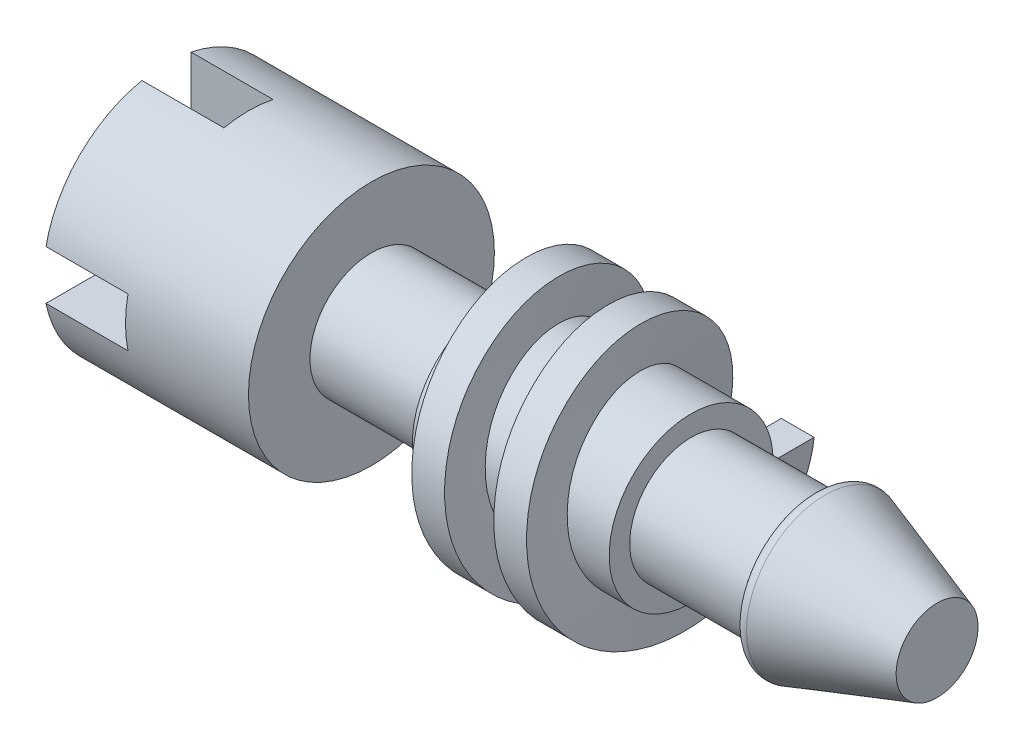
from build123d import *

# Parameters (mm, degrees)
SKETCH1_R           = 0.75
BOSS_EXTRUDE4_DEPTH = 1.5
SKETCH1_6_R         = 1.5
BOSS_EXTRUDE5_DEPTH = 2.5
BOSS_EXTRUDE6_START = 1.5
SKETCH1_7_R         = 1
BOSS_EXTRUDE6_DEPTH = 2.4
SWEEP2_PITCH        = 1
BOSS_EXTRUDE7_START = 3.9
SKETCH1_8_R         = 0.75
BOSS_EXTRUDE7_DEPTH = 1.5
CUT_EXTRUDE2_START  = -1
CUT_EXTRUDE2_DEPTH  = 1
FILLET2_R           = 0.1


with BuildPart() as part:
    # Sketch1 → Boss-Extrude4 (new body)
    with BuildSketch(Plane(origin=(0, 0, 0), x_dir=(0, 0, -1), z_dir=(1, 0, 0))):
        Circle(SKETCH1_R)
    extrude(amount=BOSS_EXTRUDE4_DEPTH)

    # Sketch1<6> → Boss-Extrude5 (add)
    with BuildSketch(Plane(origin=(0, 0, 0), x_dir=(0, 0, -1), z_dir=(1, 0, 0))):
        Circle(SKETCH1_6_R)
    extrude(amount=-BOSS_EXTRUDE5_DEPTH)

    # Sketch1<7> → Boss-Extrude6 (add)
    with BuildSketch(Plane(origin=(0, 0, 0), x_dir=(0, 0, -1), z_dir=(1, 0, 0)).offset(BOSS_EXTRUDE6_START)):
        Circle(SKETCH1_7_R)
    extrude(amount=BOSS_EXTRUDE6_DEPTH)

    # Sweep2: the profile of Sketch7 profile screwed along a right-hand helix of 2 turns, 8 arcs to a turn; built about Z, then put on its axis
    sweep2_z = Axis((0, 0, 0), (0, 0, 1))
    sweep2_corners = [(1.5003, 0, -0.25), (1.5003, 0, 0.15), (1, 0, 0.15), (1, 0, -0.25)]
    with BuildLine(mode=Mode.PRIVATE) as sweep2_profile:
        Line(sweep2_corners[0], sweep2_corners[1])
        Line(sweep2_corners[1], sweep2_corners[2])
        Line(sweep2_corners[2], sweep2_corners[3])
        Line(sweep2_corners[3], sweep2_corners[0])
    sweep2_cap = Face(sweep2_profile.wire())
    sweep2_turn_angles = [0, 22.5, 45, 67.5, 90, 112.5, 135, 157.5, 180, 202.5, 225, 247.5, 270, 292.5, 315, 337.5, 360]
    sweep2_turn_weights = [1, 0.9238795325112867, 1, 0.9238795325112867, 1, 0.9238795325112867, 1, 0.9238795325112867, 1, 0.9238795325112867, 1, 0.9238795325112867, 1, 0.9238795325112867, 1, 0.9238795325112867, 1]
    sweep2_turn_rails = [Edge.make_bspline([Vector(p[0], p[1], 0).rotate(sweep2_z, sweep2_turn_angles[k]) / sweep2_turn_weights[k] + Vector(0, 0, p[2] + SWEEP2_PITCH * sweep2_turn_angles[k] / 360) for k in range(17)], [0, 0, 0, 1, 1, 2, 2, 3, 3, 4, 4, 5, 5, 6, 6, 7, 7, 8, 8, 8], 2, sweep2_turn_weights) for p in sweep2_corners]
    sweep2_turn_sides = [Face.make_surface_from_curves(sweep2_turn_rails[p[0]], sweep2_turn_rails[p[1]]) for p in [(0, 1), (1, 2), (2, 3), (3, 0)]]
    sweep2 = Plane(origin=(1.75, 0, 0), x_dir=(0, 0, -1), z_dir=(1, 0, 0)) * Solid(Shell([*[p.moved(Location((0, 0, SWEEP2_PITCH * i))) for i in range(2) for p in sweep2_turn_sides], sweep2_cap, sweep2_cap.rotate(sweep2_z, 720).moved(Location((0, 0, SWEEP2_PITCH * 720 / 360)))]))
    add(sweep2)

    # Sketch1<8> → Boss-Extrude7 (add)
    with BuildSketch(Plane(origin=(0, 0, 0), x_dir=(0, 0, -1), z_dir=(1, 0, 0)).offset(BOSS_EXTRUDE7_START)):
        Circle(SKETCH1_8_R)
    extrude(amount=BOSS_EXTRUDE7_DEPTH)

    # Sketch8 → Cut-Extrude2 (cut)
    with BuildSketch(Plane.ZY.offset(2.5).offset(CUT_EXTRUDE2_START)):
        with BuildLine():
            Line((0.3, 1.469693846), (0.3, 0.3))
            Line((0.3, 0.3), (1.469693846, 0.3))
            ThreePointArc((1.469693846, 0.3), (1.5, 0), (1.469693846, -0.3))
            Line((1.469693846, -0.3), (0.3, -0.3))
            Line((0.3, -0.3), (0.3, -1.469693846))
            ThreePointArc((0.3, -1.469693846), (0, -1.5), (-0.3, -1.469693846))
            Line((-0.3, -1.469693846), (-0.3, -0.3))
            Line((-0.3, -0.3), (-1.469693846, -0.3))
            ThreePointArc((-1.469693846, -0.3), (-1.5, 0), (-1.469693846, 0.3))
            Line((-1.469693846, 0.3), (-0.3, 0.3))
            Line((-0.3, 0.3), (-0.3, 1.469693846))
            ThreePointArc((-0.3, 1.469693846), (0, 1.5), (0.3, 1.469693846))
        make_face()
    extrude(amount=CUT_EXTRUDE2_DEPTH, mode=Mode.SUBTRACT)

    # Sketch9 → Revolve2 (revolve)
    with BuildSketch(Plane(origin=(0, 0, 0), x_dir=(1, 0, 0), z_dir=(0, 1, 0)), mode=Mode.PRIVATE) as revolve2_sk:
        Polygon((5.4, 0), (5.4, 1), (6.9, 0.5), (6.9, 0), align=None)
    revolve(revolve2_sk.sketch.rotate(Axis((0, 0, 0), (1, 0, 0)), 180), axis=Axis((0, 0, 0), (1, 0, 0)))

    # Fillet2
    fillet2_edges = [part.edges().sort_by_distance(p)[0] for p in [
        (5.4, 0, -1),
    ]]
    fillet(fillet2_edges, radius=FILLET2_R)


solid = part.part
